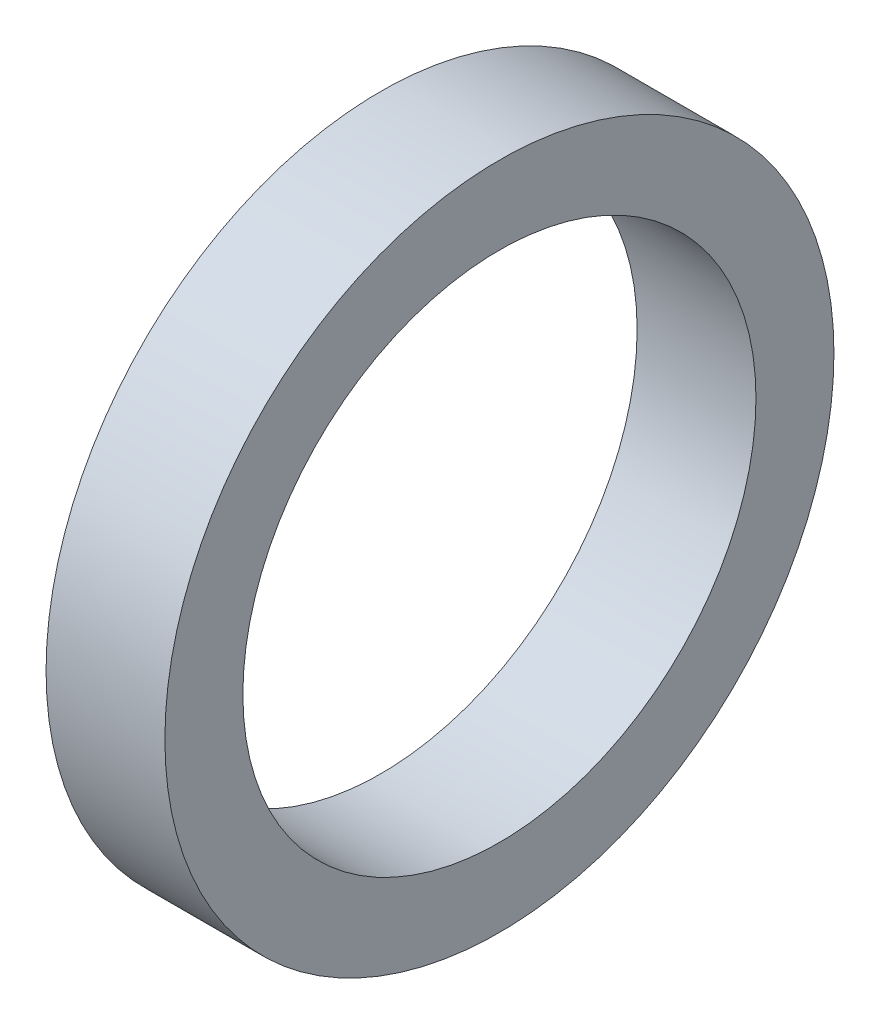
from build123d import *

# Parameters (mm, degrees)
SKETCH1_R           = 4.22275
SKETCH1_R_2         = 3.2385
BOSS_EXTRUDE1_DEPTH = 1.500000048


with BuildPart() as part:
    # Sketch1 → Boss-Extrude1 (new body)
    with BuildSketch(Plane(origin=(0, 0, 0), x_dir=(0, 0, -1), z_dir=(1, 0, 0))):
        Circle(SKETCH1_R)
        Circle(SKETCH1_R_2, mode=Mode.SUBTRACT)
    extrude(amount=BOSS_EXTRUDE1_DEPTH)


solid = part.part
